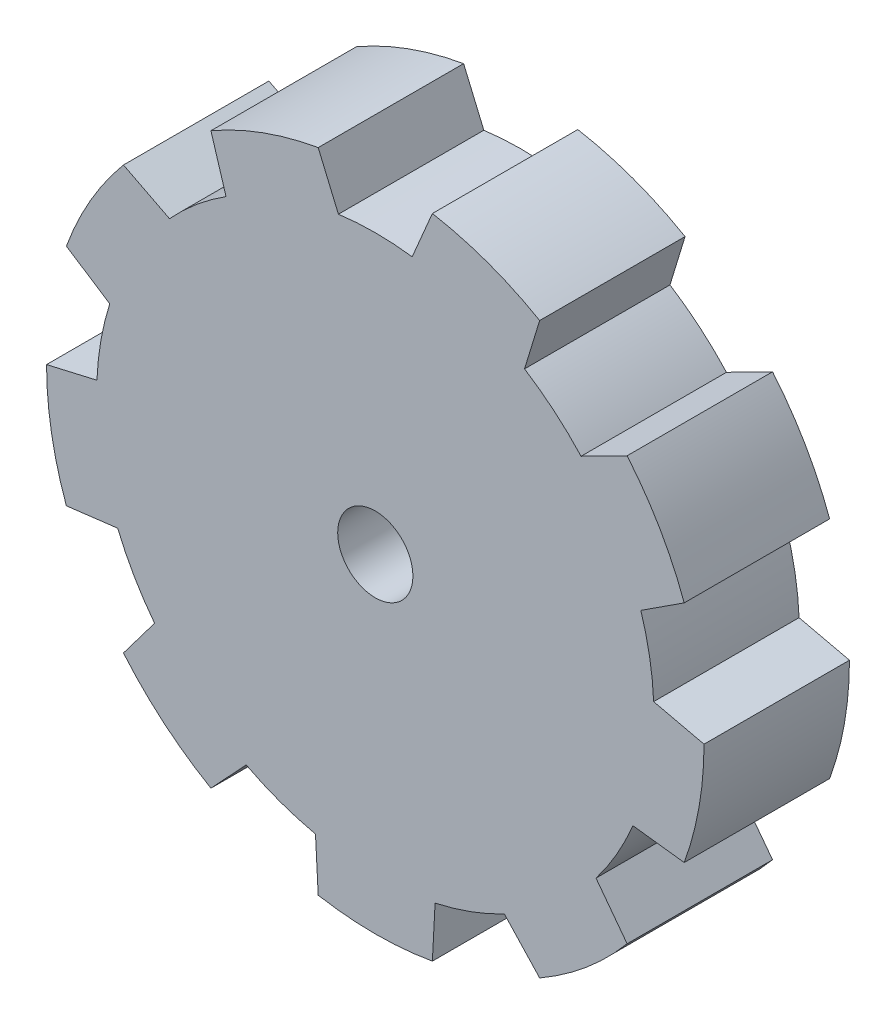
from build123d import *

# Parameters (mm, degrees)
SKETCH1_R           = 33.301933076
BOSS_EXTRUDE1_DEPTH = 14.732
CUT_EXTRUDE1_DEPTH  = 14.732
CIRPATTERN1_COUNT   = 9
CUT_EXTRUDE2_REACH  = 51.346
SKETCH3_R           = 3.81


with BuildPart() as part:
    # Sketch1 → Boss-Extrude1 (new body)
    with BuildSketch(Plane.XY):
        Circle(SKETCH1_R)
    extrude(amount=BOSS_EXTRUDE1_DEPTH)

    # Sketch2 → Cut-Extrude1 (cut)
    with BuildSketch(Plane(origin=(0, 0, 0), x_dir=(-1, 0, 0), z_dir=(0, 0, -1))):
        with BuildLine():
            Line((33.301933076, 0), (28.197316528, 1.178493589))
            ThreePointArc((28.197316528, 1.178493589), (27.793178498, 4.900687249), (26.899878814, 8.536628511))
            Line((26.899878814, 8.536628511), (31.293580769, 11.389931924))
            ThreePointArc((31.293580769, 11.389931924), (32.796001883, 5.782819991), (33.301933076, 0))
        make_face()
    cut_extrude1 = extrude(amount=-CUT_EXTRUDE1_DEPTH, mode=Mode.SUBTRACT)

    # CirPattern1: Cut-Extrude1 ×9 about axis
    cirpattern1_axis = Axis((0, 0, 14.732), (0, 0, -1))
    for i in range(1, CIRPATTERN1_COUNT):
        add(cut_extrude1.rotate(cirpattern1_axis, i * 360 / CIRPATTERN1_COUNT), mode=Mode.SUBTRACT)

    # Sketch3 → Cut-Extrude2 (cut, up to next)
    with BuildSketch(Plane(origin=(0, 0, 0), x_dir=(-1, 0, 0), z_dir=(0, 0, -1)), mode=Mode.PRIVATE) as cut_extrude2_sk1:
        Circle(SKETCH3_R)
    cut_extrude2_tool1 = extrude(cut_extrude2_sk1.sketch, amount=-CUT_EXTRUDE2_REACH, mode=Mode.PRIVATE) & part.part
    add(cut_extrude2_tool1.solids().sort_by_distance((0, 0, 0))[0], mode=Mode.SUBTRACT)


solid = part.part
